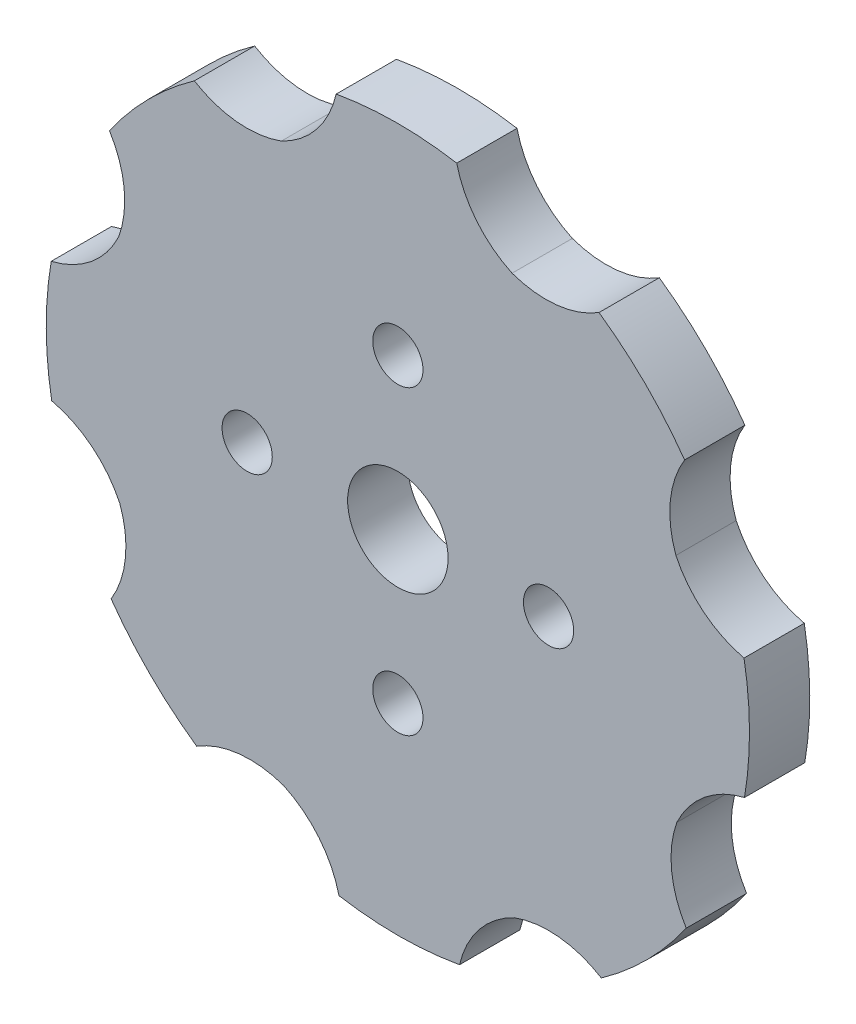
from build123d import *

# Parameters (mm, degrees)
SKETCH1_R           = 2.5
SKETCH1_R_2         = 5
BOSS_EXTRUDE1_DEPTH = 6
FILLET1_R           = 10


with BuildPart() as part:
    # Sketch1 → Boss-Extrude1 (new body)
    with BuildSketch(Plane.XY):
        with BuildLine():
            Line((-6.140421203, 34.4571506), (-7.075568353, 29.153667565))
            ThreePointArc((-7.075568353, 29.153667565), (-11.615235602, 27.660193454), (-15.860146326, 25.464794492))
            Line((-15.860146326, 25.464794492), (-20.256034573, 28.54282858))
            ThreePointArc((-20.256034573, 28.54282858), (-24.849292098, 24.647772358), (-28.706818321, 20.022951378))
            Line((-28.706818321, 20.022951378), (-25.617938395, 15.611573668))
            ThreePointArc((-25.617938395, 15.611573668), (-27.77192222, 11.345498501), (-29.221145884, 6.791511849))
            Line((-29.221145884, 6.791511849), (-34.50600705, 5.859648236))
            ThreePointArc((-34.50600705, 5.859648236), (-34.999709926, -0.142495975), (-34.4571506, -6.140421203))
            Line((-34.4571506, -6.140421203), (-29.153667565, -7.075568353))
            ThreePointArc((-29.153667565, -7.075568353), (-27.660193454, -11.615235602), (-25.464794492, -15.860146326))
            Line((-25.464794492, -15.860146326), (-28.54282858, -20.256034573))
            ThreePointArc((-28.54282858, -20.256034573), (-24.647772358, -24.849292098), (-20.022951378, -28.706818321))
            Line((-20.022951378, -28.706818321), (-15.611573668, -25.617938395))
            ThreePointArc((-15.611573668, -25.617938395), (-11.345498501, -27.77192222), (-6.791511849, -29.221145884))
            Line((-6.791511849, -29.221145884), (-5.859648236, -34.50600705))
            ThreePointArc((-5.859648236, -34.50600705), (0.142495975, -34.999709926), (6.140421203, -34.4571506))
            Line((6.140421203, -34.4571506), (7.075568353, -29.153667565))
            ThreePointArc((7.075568353, -29.153667565), (11.615235602, -27.660193454), (15.860146326, -25.464794492))
            Line((15.860146326, -25.464794492), (20.256034573, -28.54282858))
            ThreePointArc((20.256034573, -28.54282858), (24.849292098, -24.647772358), (28.706818321, -20.022951378))
            Line((28.706818321, -20.022951378), (25.617938395, -15.611573668))
            ThreePointArc((25.617938395, -15.611573668), (27.77192222, -11.345498501), (29.221145884, -6.791511849))
            Line((29.221145884, -6.791511849), (34.50600705, -5.859648236))
            ThreePointArc((34.50600705, -5.859648236), (34.999709926, 0.142495975), (34.4571506, 6.140421203))
            Line((34.4571506, 6.140421203), (29.153667565, 7.075568353))
            ThreePointArc((29.153667565, 7.075568353), (27.660193454, 11.615235602), (25.464794492, 15.860146326))
            Line((25.464794492, 15.860146326), (28.54282858, 20.256034573))
            ThreePointArc((28.54282858, 20.256034573), (24.647772358, 24.849292098), (20.022951378, 28.706818321))
            Line((20.022951378, 28.706818321), (15.611573668, 25.617938395))
            ThreePointArc((15.611573668, 25.617938395), (11.345498501, 27.77192222), (6.791511849, 29.221145884))
            Line((6.791511849, 29.221145884), (5.859648236, 34.50600705))
            ThreePointArc((5.859648236, 34.50600705), (-0.142495975, 34.999709926), (-6.140421203, 34.4571506))
        make_face()
        with Locations((0, 15)):
            Circle(SKETCH1_R, mode=Mode.SUBTRACT)
        with Locations((15, 0)):
            Circle(SKETCH1_R, mode=Mode.SUBTRACT)
        with Locations((0, -15)):
            Circle(SKETCH1_R, mode=Mode.SUBTRACT)
        with Locations((-15, 0)):
            Circle(SKETCH1_R, mode=Mode.SUBTRACT)
        Circle(SKETCH1_R_2, mode=Mode.SUBTRACT)
    extrude(amount=BOSS_EXTRUDE1_DEPTH)

    # Fillet1
    # the kernel refuses this fillet: 10 mm, written as the material it adds along each edge
    with BuildSketch(Plane(origin=(6.791511849, 29.221145884, 0), x_dir=(0.9510209214740128, -0.3091265225093435, 0), z_dir=(0, 0, 1)), Plane(origin=(25.464794492, 15.860146326, 0), x_dir=(0.45388788231358146, -0.891058802935526, 0), z_dir=(0, 0, 1)), Plane(origin=(29.221145884, -6.791511849, 0), x_dir=(-0.3091265225093466, -0.9510209214740117, 0), z_dir=(0, 0, 1)), Plane(origin=(15.860146326, -25.464794492, 0), x_dir=(-0.8910588029355269, -0.45388788231357946, 0), z_dir=(0, 0, 1)), Plane(origin=(-6.791511849, -29.221145884, 0), x_dir=(-0.9510209214740112, 0.30912652250934813, 0), z_dir=(0, 0, 1)), Plane(origin=(-25.464794492, -15.860146326, 0), x_dir=(-0.4538878823135736, 0.8910588029355299, 0), z_dir=(0, 0, 1)), Plane(origin=(-29.221145884, 6.791511849, 0), x_dir=(0.30912652250934974, 0.9510209214740107, 0), z_dir=(0, 0, 1)), Plane(origin=(-15.860146326, 25.464794492, 0), x_dir=(0.8910588029355312, 0.45388788231357124, 0), z_dir=(0, 0, 1))) as fillet1_piece_1:
        with BuildLine():
            CenterArc((6.006376492, 9.963119175), FILLET1_R, 211.501234777, 53.576426358)
            Line((-2.519912546, 4.737949778), (-2.690438327, 4.63344639))
            ThreePointArc((-2.690438327, 4.63344639), (-1.436534977, 2.27506024), (-0.176578704, -0.093914649))
            Line((-0.176578704, -0.093914649), (0.017161076, -0.199262384))
            ThreePointArc((0.017161076, -0.199262384), (2.574161354, -0.089357526), (5.131161632, -0.199262384))
            Line((5.131161632, -0.199262384), (5.148322708, 0))
        make_face()
    extrude(amount=6)
    with BuildSketch(Plane(origin=(15.611573668, 25.617938395, 0), x_dir=(0.8191520442889787, 0.5735764363510647, 0), z_dir=(0, 0, 1)), Plane(origin=(29.153667565, 7.075568353, 0), x_dir=(0.9848077530122112, -0.17364817766691212, 0), z_dir=(0, 0, 1)), Plane(origin=(25.617938395, -15.611573668, 0), x_dir=(0.5735764363510597, -0.8191520442889821, 0), z_dir=(0, 0, 1)), Plane(origin=(7.075568353, -29.153667565, 0), x_dir=(-0.1736481776669137, -0.9848077530122109, 0), z_dir=(0, 0, 1)), Plane(origin=(-15.611573668, -25.617938395, 0), x_dir=(-0.8191520442889838, -0.5735764363510576, 0), z_dir=(0, 0, 1)), Plane(origin=(-29.153667565, -7.075568353, 0), x_dir=(-0.9848077530122104, 0.17364817766691737, 0), z_dir=(0, 0, 1)), Plane(origin=(-25.617938395, 15.611573668, 0), x_dir=(-0.5735764363510546, 0.8191520442889858, 0), z_dir=(0, 0, 1)), Plane(origin=(-7.075568353, 29.153667565, 0), x_dir=(0.17364817766690768, 0.984807753012212, 0), z_dir=(0, 0, 1))) as fillet1_piece_2:
        with BuildLine():
            CenterArc((5.913554395, 9.986037501), FILLET1_R, 213.395476897, 53.576426358)
            Line((-2.435358777, 4.481889172), (-2.602337041, 4.371806205))
            ThreePointArc((-2.602337041, 4.371806205), (-1.297983622, 2.197309054), (-0.183213989, -0.080203705))
            Line((-0.183213989, -0.080203705), (0, -0.2))
            ThreePointArc((0, -0.2), (2.692648905, -0.2), (5.374732678, -0.19972075))
            Line((5.374732678, -0.19972075), (5.385297809, 0))
        make_face()
    extrude(amount=6)


solid = part.part
